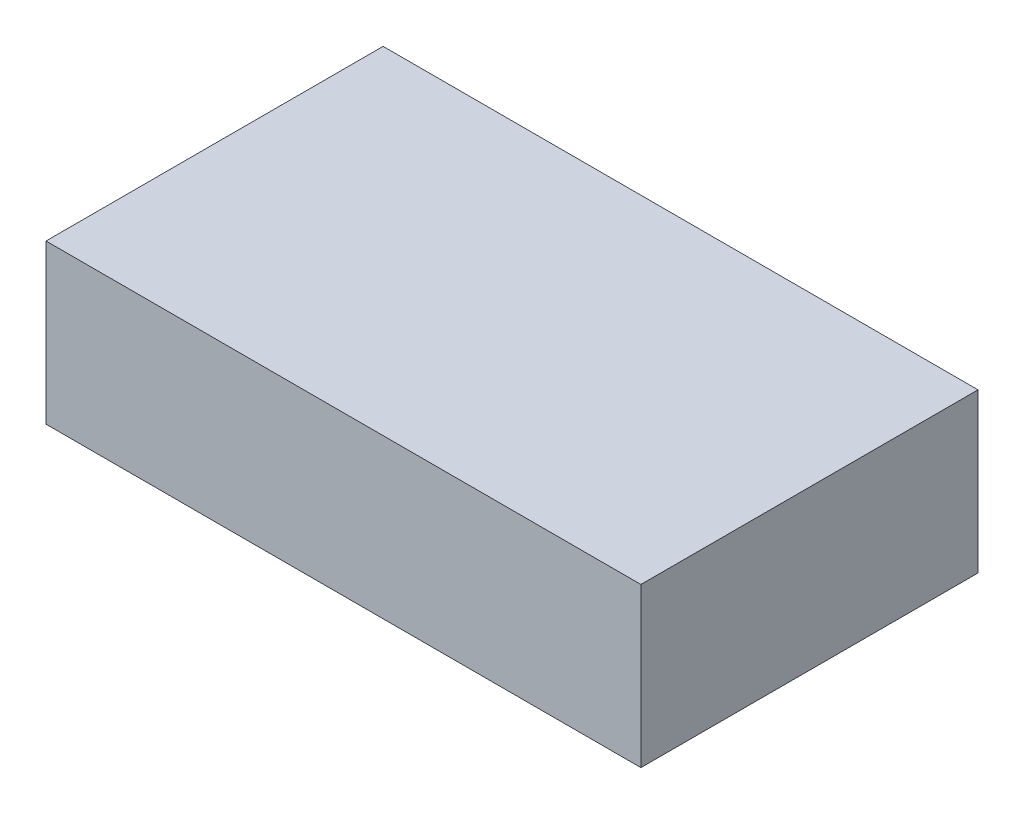
from build123d import *

# Parameters (mm, degrees)
SKETCH1_W           = 381
SKETCH1_H           = 215.9
BOSS_EXTRUDE1_DEPTH = 101.6


with BuildPart() as part:
    # Sketch1 → Boss-Extrude1 (new body)
    with BuildSketch(Plane(origin=(0, 0, 0), x_dir=(1, 0, 0), z_dir=(0, 1, 0))):
        with Locations((190.5, 107.95)):
            Rectangle(SKETCH1_W, SKETCH1_H)
    extrude(amount=BOSS_EXTRUDE1_DEPTH)


solid = part.part
